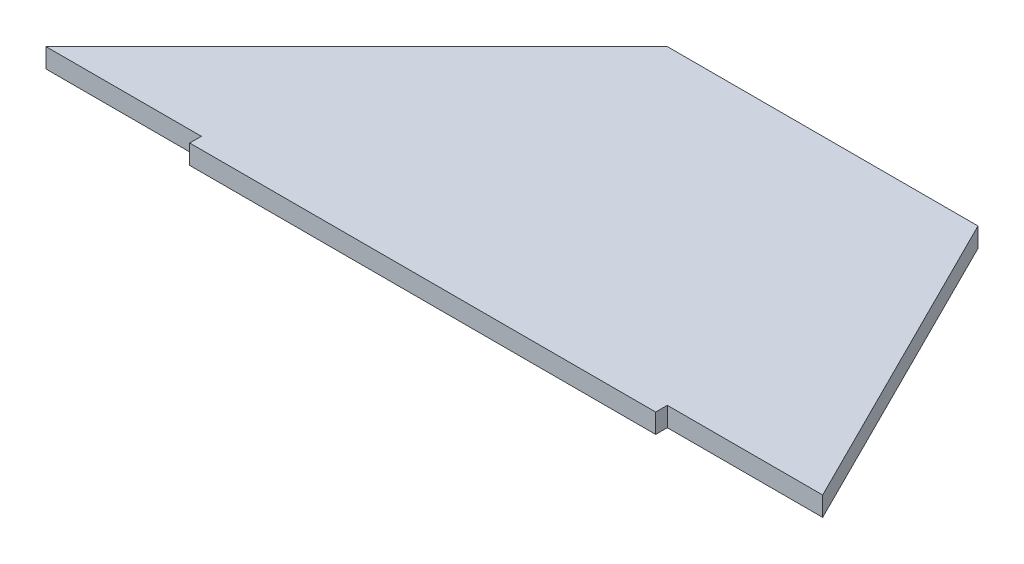
from build123d import *

# Parameters (mm, degrees)
BOSS_EXTRUDE1_DEPTH = 6.35


with BuildPart() as part:
    # Sketch2 → Boss-Extrude1 (new body)
    with BuildSketch(Plane(origin=(0, 0, 0), x_dir=(1, 0, 0), z_dir=(0, 1, 0))):
        Polygon((0, 0), (152.4, 0), (152.4, 3.81), (203.2, 3.81), (152.4, 105.41), (50.8, 105.41), (-50.8, 3.81), (0, 3.81), align=None)
    extrude(amount=BOSS_EXTRUDE1_DEPTH)


solid = part.part
